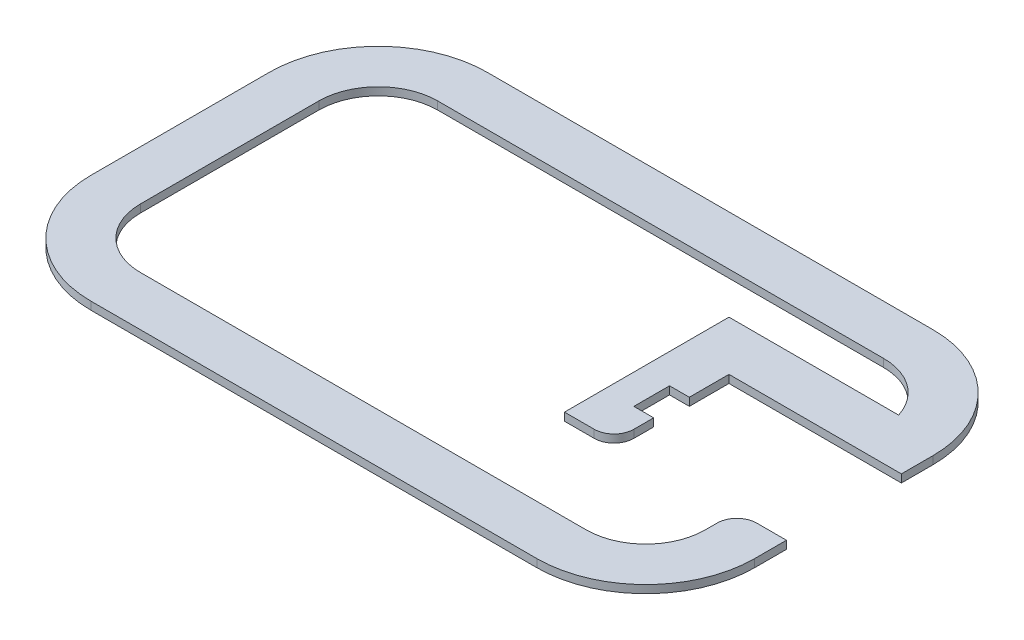
from build123d import *

# Parameters (mm, degrees)
BOSS_EXTRUDE1_DEPTH = 4


with BuildPart() as part:
    # Sketch1 → Boss-Extrude1 (new body)
    with BuildSketch(Plane(origin=(0, 0, 0), x_dir=(1, 0, 0), z_dir=(0, 1, 0))):
        with BuildLine():
            Line((335, 145), (335, 129))
            Line((335, 129), (248, 129))
            Line((248, 129), (248, 109))
            Line((248, 109), (238, 109))
            Line((238, 109), (238, 91))
            Line((238, 91), (248, 91))
            Line((248, 91), (248, 81))
            ThreePointArc((248, 81), (245.071067812, 73.928932188), (238, 71))
            Line((238, 71), (223, 71))
            Line((223, 71), (223, 91))
            Line((223, 91), (223, 109))
            Line((223, 109), (223, 154))
            Line((223, 154), (308.618176043, 154))
            ThreePointArc((308.618176043, 154), (297.748239349, 169.186773245), (280, 175))
            Line((280, 175), (55, 175))
            ThreePointArc((55, 175), (33.786796564, 166.213203436), (25, 145))
            Line((25, 145), (25, 55))
            ThreePointArc((25, 55), (33.786796564, 33.786796564), (55, 25))
            Line((55, 25), (280, 25))
            ThreePointArc((280, 25), (301.213203436, 33.786796564), (310, 55))
            Line((310, 55), (310, 61))
            ThreePointArc((310, 61), (312.928932188, 68.071067812), (320, 71))
            Line((320, 71), (335, 71))
            Line((335, 71), (335, 55))
            ThreePointArc((335, 55), (318.890872965, 16.109127035), (280, 0))
            Line((280, 0), (55, 0))
            ThreePointArc((55, 0), (16.109127035, 16.109127035), (0, 55))
            Line((0, 55), (0, 145))
            ThreePointArc((0, 145), (16.109127035, 183.890872965), (55, 200))
            Line((55, 200), (280, 200))
            ThreePointArc((280, 200), (318.890872965, 183.890872965), (335, 145))
        make_face()
    extrude(amount=BOSS_EXTRUDE1_DEPTH)


solid = part.part
